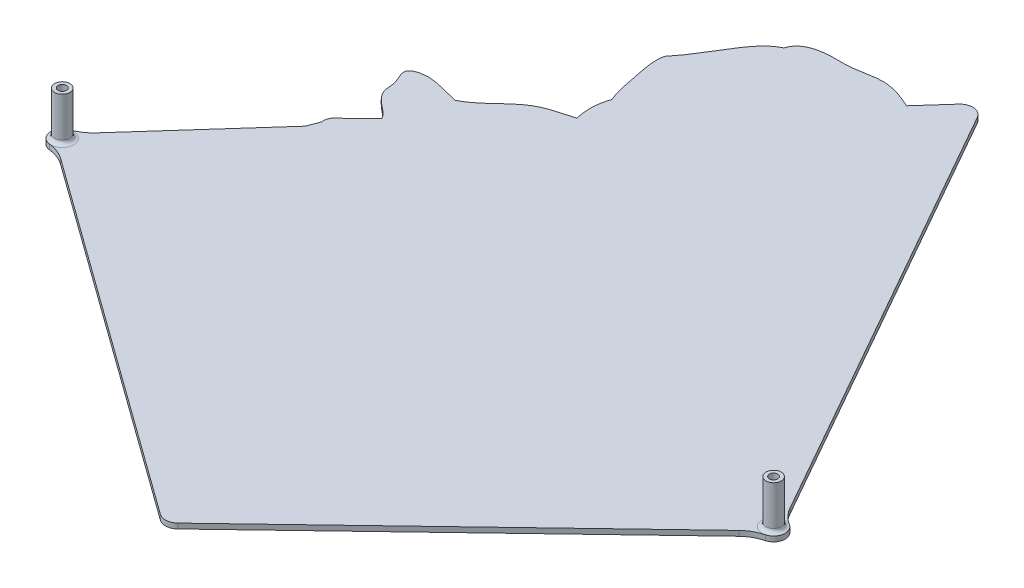
from build123d import *

# Parameters (mm, degrees)
BOSS_EXTRUDE1_DEPTH = 2
SKETCH4_R           = 3
BOSS_EXTRUDE2_DEPTH = 17
FILLET1_R           = 1.5
CUT_EXTRUDE1_REACH  = 466.623
SKETCH5_R           = 1.65
CHAMFER1_SIZE       = 1


with BuildPart() as part:
    # Sketch2 → Boss-Extrude1 (new body)
    with BuildSketch(Plane.XZ.offset(-141.565722281)):
        with BuildLine():
            Line((9.91576806, 252.305318894), (48.580957851, 209.08963313))
            ThreePointArc((48.580957851, 209.08963313), (49.426585926, 206.74773582), (50.312065062, 204.420613874))
            add(Edge.make_bspline(
                [(50.312065062, 204.420613874), (49.815719925, 202.125692192), (51.560044766, 200.071289123), (53.405414889, 199.000816343)],
                knots=[0, 0, 0, 0, 1, 1, 1, 1], degree=3))
            add(Edge.make_bspline(
                [(53.405414889, 199.000816343), (57.076134247, 195.171649715), (60.975957758, 191.578824181)],
                knots=[0, 0, 0, 1, 1, 1], degree=2))
            add(Edge.make_bspline(
                [(60.975957758, 191.578824181), (59.276356799, 188.787533968), (55.182188202, 186.765240329), (51.507120094, 181.679398586), (51.746441808, 177.662253704), (50.346054048, 174.409460226), (48.259810349, 169.791087363), (55.44455623, 167.87412447), (61.554904622, 169.170927623), (66.389807102, 170.392534118), (69.033229794, 171.05360611)],
                knots=[0, 0, 0, 0, 0.209803025, 0.299929842, 0.400822309, 0.462711074, 0.545891619, 0.679734995, 0.814877394, 1, 1, 1, 1], degree=3))
            add(Edge.make_bspline(
                [(69.033229794, 171.05360611), (75.789670793, 167.856586879), (82.863128392, 156.836801796), (94.903748146, 154.565768109), (98.968161166, 153.292574822)],
                knots=[0, 0, 0, 0, 0.635604539, 1, 1, 1, 1], degree=3))
            add(Edge.make_bspline(
                [(98.968161166, 153.292574822), (97.222932023, 146.593007734), (99.500446297, 140.061549094)],
                knots=[0, 0, 0, 1, 1, 1], degree=2))
            add(Edge.make_bspline(
                [(99.500446297, 140.061549094), (97.755365245, 136.29700673), (96.608153873, 127.913172296), (94.363718049, 119.605147548), (95.128629781, 115.204359992)],
                knots=[0, 0, 0, 0, 0.482786435, 1, 1, 1, 1], degree=3))
            add(Edge.make_bspline(
                [(95.128629781, 115.204359992), (99.531359662, 110.027059936), (104.66045627, 100.101106742), (111.48377488, 91.017928675), (115.654612237, 88.962550112)],
                knots=[0, 0, 0, 0, 0.601104085, 1, 1, 1, 1], degree=3))
            add(Edge.make_bspline(
                [(115.654612237, 88.962550112), (117.154809763, 84.078670542), (125.513466275, 82.144069756), (136.374508774, 82.918595796), (147.178985025, 79.455312781), (155.38375, 82.787729708), (159.272458823, 84.593804464)],
                knots=[0, 0, 0, 0, 0.302255882, 0.465040863, 0.717430044, 1, 1, 1, 1], degree=3))
            Line((159.272458823, 84.593804464), (168.955344378, 73.762703811))
            ThreePointArc((168.955344378, 73.762703811), (173.217178272, 72.123753177), (177.033466995, 74.630808761))
            Line((177.033466995, 74.630808761), (272.938128905, 243.941637963))
            ThreePointArc((272.938128905, 243.941637963), (275.235163101, 247.005225563), (278.23300909, 249.387420874))
            ThreePointArc((278.23300909, 249.387420874), (280.35792161, 253.895055054), (277.023119072, 257.598176865))
            ThreePointArc((277.023119072, 257.598176865), (273.465559128, 259.01440507), (270.382479394, 261.285209868))
            Line((270.382479394, 261.285209868), (158.112964228, 368.595076844))
            ThreePointArc((158.112964228, 368.595076844), (155.002737967, 369.968720655), (151.733177312, 369.035780231))
            Line((151.733177312, 369.035780231), (11.614262021, 267.968166154))
            ThreePointArc((11.614262021, 267.968166154), (8.248230389, 266.142853542), (4.529729577, 265.229241593))
            ThreePointArc((4.529729577, 265.229241593), (0.563089763, 261.243048943), (3.583038224, 256.499224057))
            ThreePointArc((3.583038224, 256.499224057), (7.019257656, 254.809747483), (9.91576806, 252.305318894))
        make_face()
    extrude(amount=-BOSS_EXTRUDE1_DEPTH)

    # Sketch4 → Boss-Extrude2 (add)
    with BuildSketch(Plane(origin=(0, 143.565722281, 0), x_dir=(1, 0, 0), z_dir=(0, 1, 0))):
        with Locations(Location((5.036862118, -260.757908841, 0), (0, 0, 270))):
            Circle(SKETCH4_R)
        with Locations(Location((275.905995025, -253.239044628, 0), (0, 0, 270))):
            Circle(SKETCH4_R)
    extrude(amount=BOSS_EXTRUDE2_DEPTH)

    # Fillet1
    fillet1_edges = [part.edges().sort_by_distance(p)[0] for p in [
        (5.036862118, 143.565722281, 257.757908841),
        (275.905995025, 143.565722281, 250.239044628),
    ]]
    fillet(fillet1_edges, radius=FILLET1_R - 0.0001)  # a hair under: the kernel refuses the full size

    # Sketch5 → Cut-Extrude1 (cut, up to next)
    with BuildSketch(Plane.XZ.offset(-141.565722281), mode=Mode.PRIVATE) as cut_extrude1_sk1:
        with Locations(Location((275.905995025, 253.239044628, 0), (0, 0, 270))):
            Circle(SKETCH5_R)
    cut_extrude1_tool1 = extrude(cut_extrude1_sk1.sketch, amount=-CUT_EXTRUDE1_REACH, mode=Mode.PRIVATE) & part.part
    # Sketch5 → Cut-Extrude1 (cut, up to next)
    with BuildSketch(Plane.XZ.offset(-141.565722281), mode=Mode.PRIVATE) as cut_extrude1_sk2:
        with Locations(Location((5.036862118, 260.757908841, 0), (0, 0, 270))):
            Circle(SKETCH5_R)
    cut_extrude1_tool2 = extrude(cut_extrude1_sk2.sketch, amount=-CUT_EXTRUDE1_REACH, mode=Mode.PRIVATE) & part.part
    add(cut_extrude1_tool1.solids().sort_by_distance((275.905995, 141.565722, 253.239045))[0], mode=Mode.SUBTRACT)
    add(cut_extrude1_tool2.solids().sort_by_distance((5.036862, 141.565722, 260.757909))[0], mode=Mode.SUBTRACT)

    # Chamfer1
    chamfer1_edges = [part.edges().sort_by_distance(p)[0] for p in [
        (275.905995025, 141.565722281, 254.889044628),
        (5.036862118, 141.565722281, 262.407908841),
    ]]
    chamfer(chamfer1_edges, length=CHAMFER1_SIZE)


solid = part.part
